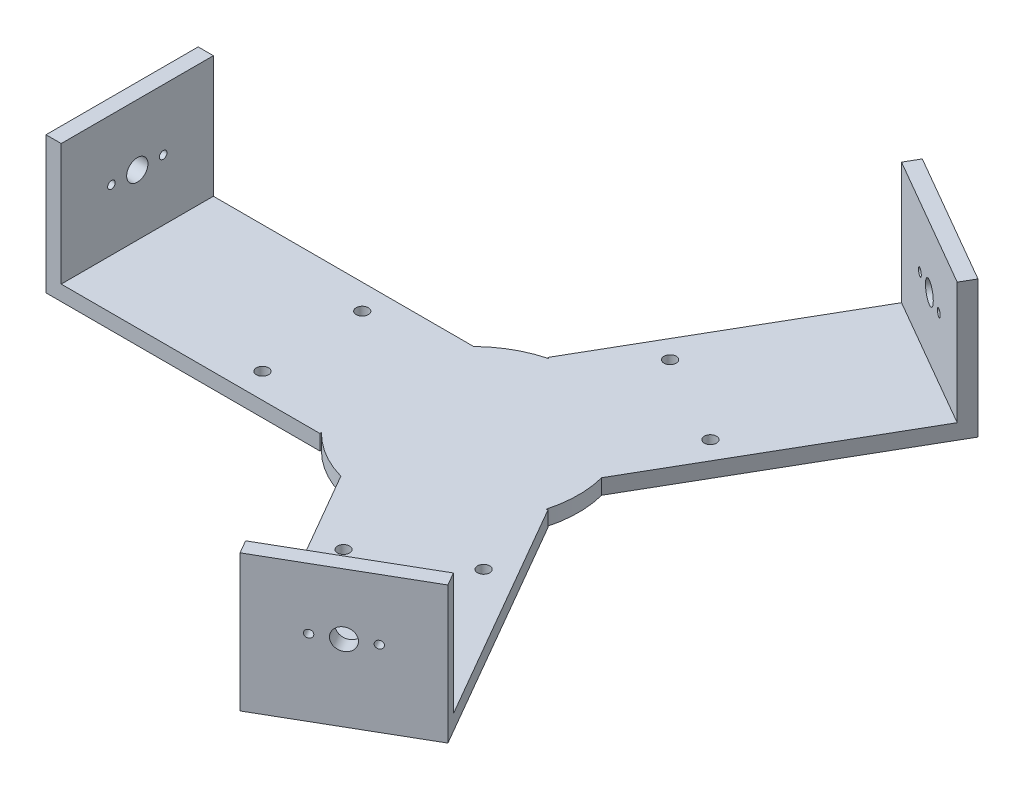
from build123d import *

# Parameters (mm, degrees)
BOSS_EXTRU_3_DEPTH      = 5
ESQUISSE4_W             = 5
ESQUISSE4_H             = 50
BOSS_EXTRU_4_DEPTH      = 40
ESQUISSE5_R             = 3.5
ESQUISSE5_R_2           = 1.25
ENL_V_MAT_EXTRU_1_DEPTH = 225.427684996
ESQUISSE6_R             = 3.5
ESQUISSE6_R_2           = 1.25
ENL_V_MAT_EXTRU_2_DEPTH = 272.884889055
ESQUISSE7_R             = 3.5
ESQUISSE7_R_2           = 1.25
ENL_V_MAT_EXTRU_3_DEPTH = 272.884889055
ESQUISSE8_R             = 2
ENL_V_MAT_EXTRU_4_DEPTH = 166.498710073


with BuildPart() as part:
    # Esquisse3 → Boss.-Extru.3 (new body)
    with BuildSketch(Plane(origin=(0, 0, 0), x_dir=(1, 0, 0), z_dir=(0, 1, 0))):
        with BuildLine():
            Line((-115, -25), (-25, -25))
            Line((-25, -25), (-24.99494949, -24.500051021))
            ThreePointArc((-24.99494949, -24.500051021), (-17.805293657, -30.132565736), (-9.403186381, -33.713203436))
            Line((-9.403186381, -33.713203436), (35.849364905, -112.092921435))
            Line((35.849364905, -112.092921435), (79.150635095, -87.092921435))
            Line((79.150635095, -87.092921435), (34.150635095, -9.150635095))
            Line((34.150635095, -9.150635095), (33.715141323, -9.396235714))
            ThreePointArc((33.715141323, -9.396235714), (34.998214236, -0.353553761), (33.898083809, 8.713203436))
            Line((33.898083809, 8.713203436), (79.150635095, 87.092921435))
            Line((79.150635095, 87.092921435), (35.849364905, 112.092921435))
            Line((35.849364905, 112.092921435), (-9.150635095, 34.150635095))
            Line((-9.150635095, 34.150635095), (-8.720191833, 33.896286735))
            ThreePointArc((-8.720191833, 33.896286735), (-17.19292058, 30.486119496), (-24.494897428, 25))
            Line((-24.494897428, 25), (-115, 25))
            Line((-115, 25), (-115, -25))
        make_face()
    extrude(amount=BOSS_EXTRU_3_DEPTH)

    # Esquisse4 → Boss.-Extru.4 (add)
    with BuildSketch(Plane(origin=(0, 5, 0), x_dir=(1, 0, 0), z_dir=(0, 1, 0))):
        with Locations((-112.5, 0)):
            Rectangle(ESQUISSE4_W, ESQUISSE4_H)
        Polygon((35.849364905, 112.092921435), (79.150635095, 87.092921435), (76.650635095, 82.762794416), (33.349364905, 107.762794416), align=None)
        Polygon((79.150635095, -87.092921435), (76.650635095, -82.762794416), (33.349364905, -107.762794416), (35.849364905, -112.092921435), align=None)
    extrude(amount=BOSS_EXTRU_4_DEPTH)

    # Esquisse5 → Enlèv. mat.-Extru.1 (cut, through all)
    with BuildSketch(Plane(origin=(-110, 0, 0), x_dir=(0, 0, -1), z_dir=(1, 0, 0))):
        with Locations((0, 25)):
            Circle(ESQUISSE5_R)
        with Locations((-8.5, 25)):
            Circle(ESQUISSE5_R_2)
        with Locations((8.5, 25)):
            Circle(ESQUISSE5_R_2)
    extrude(amount=-ENL_V_MAT_EXTRU_1_DEPTH, mode=Mode.SUBTRACT)

    # Esquisse6 → Enlèv. mat.-Extru.2 (cut, through all)
    with BuildSketch(Plane(origin=(55, 0, 95.262794416), x_dir=(-0.8660254037844386, 0, 0.4999999999999999), z_dir=(-0.49999999999999994, 0, -0.8660254037844387))):
        with Locations((0, 25)):
            Circle(ESQUISSE6_R)
        with Locations((-8.5, 25)):
            Circle(ESQUISSE6_R_2)
        with Locations((8.5, 25)):
            Circle(ESQUISSE6_R_2)
    extrude(amount=-ENL_V_MAT_EXTRU_2_DEPTH, mode=Mode.SUBTRACT)

    # Esquisse7 → Enlèv. mat.-Extru.3 (cut, through all)
    with BuildSketch(Plane(origin=(55, 0, -95.262794416), x_dir=(0.8660254037844388, 0, 0.49999999999999983), z_dir=(-0.4999999999999998, 0, 0.8660254037844387))):
        with Locations((0, 25)):
            Circle(ESQUISSE7_R)
        with Locations((8.5, 25)):
            Circle(ESQUISSE7_R_2)
        with Locations((-8.5, 25)):
            Circle(ESQUISSE7_R_2)
    extrude(amount=-ENL_V_MAT_EXTRU_3_DEPTH, mode=Mode.SUBTRACT)

    # Esquisse8 → Enlèv. mat.-Extru.4 (cut, through all)
    with BuildSketch(Plane(origin=(0, 5, 0), x_dir=(1, 0, 0), z_dir=(0, 1, 0))):
        with Locations((11.915763974, -54.138708614)):
            Circle(ESQUISSE8_R)
        with Locations((40.568493854, -36.766692542)):
            Circle(ESQUISSE8_R)
        with Locations((11.556642828, 53.516692542)):
            Circle(ESQUISSE8_R)
        with Locations((40.927615001, 37.388708614)):
            Circle(ESQUISSE8_R)
        with Locations((-52.125136682, -16.75)):
            Circle(ESQUISSE8_R)
        with Locations((-52.843378975, 16.75)):
            Circle(ESQUISSE8_R)
    extrude(amount=-ENL_V_MAT_EXTRU_4_DEPTH, mode=Mode.SUBTRACT)


solid = part.part
